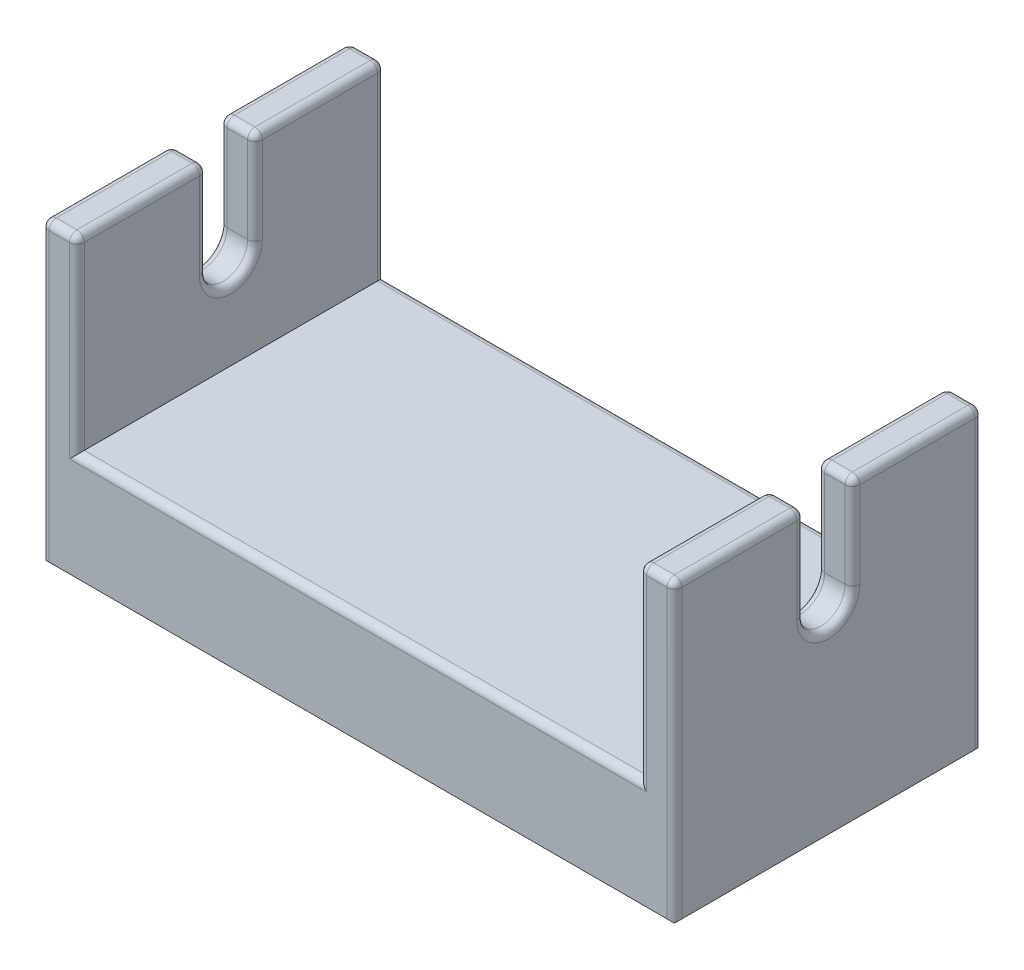
from build123d import *

# Parameters (mm, degrees)
SKETCH2_W           = 85.7504
SKETCH2_H           = 41.725641227
BOSS_EXTRUDE1_DEPTH = 15
SKETCH2_3_W         = 4.7752
SKETCH2_3_H         = 41.725641227
BOSS_EXTRUDE2_DEPTH = 25.4
CUT_EXTRUDE1_DEPTH  = 113.349989924
CHAMFER1_SIZE       = 0.5
FILLET2_R           = 1


with BuildPart() as part:
    # Sketch2 → Boss-Extrude1 (new body)
    with BuildSketch(Plane(origin=(0, 34, 0), x_dir=(-1, 0, 0), z_dir=(0, -1, 0))):
        with Locations((-150, -20.862820614)):
            Rectangle(SKETCH2_W, SKETCH2_H)
    extrude(amount=BOSS_EXTRUDE1_DEPTH)

    # Sketch2<3> → Boss-Extrude2 (add)
    with BuildSketch(Plane(origin=(0, 34, 0), x_dir=(-1, 0, 0), z_dir=(0, -1, 0))):
        with Locations((-109.5124, -20.862820614)):
            Rectangle(SKETCH2_3_W, SKETCH2_3_H)
        with Locations((-190.4876, -20.862820614)):
            Rectangle(SKETCH2_3_W, SKETCH2_3_H)
    extrude(amount=-BOSS_EXTRUDE2_DEPTH)

    # Sketch3 → Cut-Extrude1 (cut, through all)
    with BuildSketch(Plane(origin=(192.8752, 0, 0), x_dir=(0, 0, -1), z_dir=(1, 0, 0))):
        with BuildLine():
            Line((-24.126720614, 46.7), (-24.126720614, 59.4))
            Line((-24.126720614, 59.4), (-17.598920614, 59.4))
            Line((-17.598920614, 59.4), (-17.598920614, 46.7))
            ThreePointArc((-17.598920614, 46.7), (-20.862820614, 43.4361), (-24.126720614, 46.7))
        make_face()
    extrude(amount=-CUT_EXTRUDE1_DEPTH, mode=Mode.SUBTRACT)

    # Chamfer1
    chamfer1_edges = [part.edges().sort_by_distance(p)[0] for p in [
        (150, 19, 41.725641227),
        (192.8752, 19, 20.862820614),
        (150, 19, 0),
        (107.1248, 19, 20.862820614),
    ]]
    chamfer(chamfer1_edges, length=CHAMFER1_SIZE)

    # Fillet2
    fillet2_edges = [part.edges().sort_by_distance(p)[0] for p in [
        (111.9, 53.05, 17.598920614),
        (111.9, 43.4361, 20.862820614),
        (107.1248, 53.05, 17.598920614),
        (107.1248, 43.4361, 20.862820614),
        (192.8752, 53.05, 17.598920614),
        (192.8752, 43.4361, 20.862820614),
        (188.1, 53.05, 17.598920614),
        (188.1, 43.4361, 20.862820614),
        (109.5124, 59.4, 0),
        (111.9, 59.4, 8.799460307),
        (109.5124, 59.4, 17.598920614),
        (107.1248, 59.4, 8.799460307),
        (109.5124, 59.4, 41.725641227),
        (107.1248, 59.4, 32.92618092),
        (111.9, 59.4, 32.92618092),
        (190.4876, 59.4, 0),
        (192.8752, 59.4, 8.799460307),
        (190.4876, 59.4, 17.598920614),
        (188.1, 59.4, 8.799460307),
        (190.4876, 59.4, 41.725641227),
        (188.1, 59.4, 32.92618092),
        (192.8752, 59.4, 32.92618092),
        (111.9, 53.05, 24.126720614),
        (109.5124, 59.4, 24.126720614),
        (107.1248, 53.05, 24.126720614),
        (192.8752, 53.05, 24.126720614),
        (190.4876, 59.4, 24.126720614),
        (188.1, 53.05, 24.126720614),
        (150, 34, 41.725641227),
        (107.1248, 39.45, 41.725641227),
        (188.1, 46.7, 41.725641227),
        (111.9, 46.7, 41.725641227),
        (192.8752, 39.45, 41.725641227),
        (107.1248, 39.45, 0),
        (192.8752, 39.45, 0),
        (188.1, 46.7, 0),
        (150, 34, 0),
        (111.9, 46.7, 0),
    ]]
    fillet(fillet2_edges, radius=FILLET2_R)


solid = part.part
